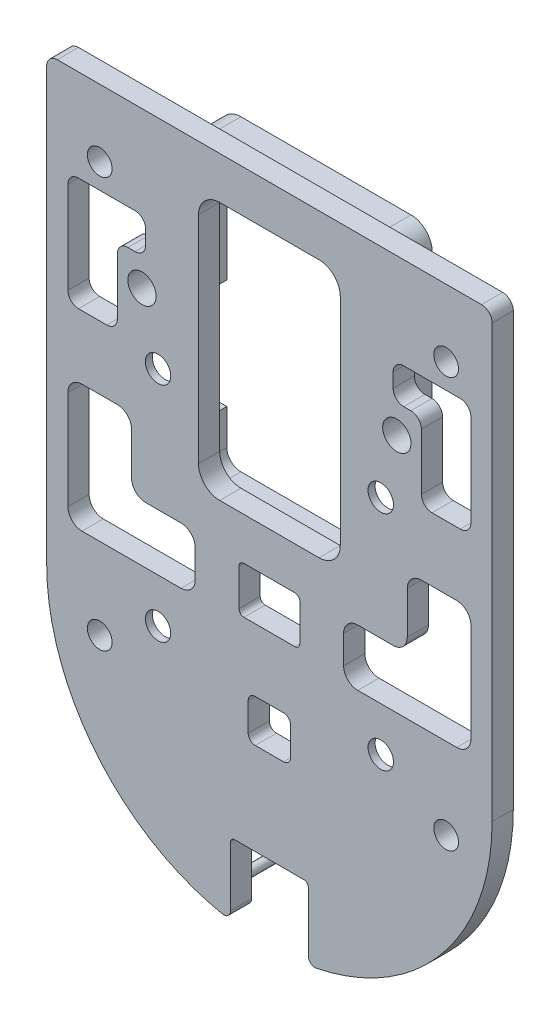
from build123d import *

# Parameters (mm, degrees)
CROQUIS1_R                   = 1.5
SALIENTE_EXTRUIR1_DEPTH      = 3
CROQUIS3_R                   = 0.65
CORTAR_EXTRUIR1_DEPTH        = 57.244999778
CROQUIS5_R                   = 0.65
CROQUIS5_R_2                 = 1.8
CROQUIS5_R_3                 = 1.5
CORTAR_EXTRUIR3_DEPTH        = 57.244999778
REDONDEO1_R                  = 1
SALIENTE_EXTRUIR2_DEPTH      = 5
SALIENTE_EXTRUIR2_DEPTH_BACK = 3
CROQUIS14_R                  = 0.65
SALIENTE_EXTRUIR3_DEPTH      = 5
CROQUIS22_R                  = 2
CORTAR_EXTRUIR14_DEPTH       = 30
CORTAR_EXTRUIR9_DEPTH        = 30
CORTAR_EXTRUIR9_DEPTH_BACK   = 2
CROQUIS16_R                  = 4.8
CROQUIS16_R_2                = 1.8
CORTAR_EXTRUIR15_DEPTH       = 5
CROQUIS11_R                  = 1.75
CORTAR_EXTRUIR6_DEPTH        = 52
CORTAR_EXTRUIR16_DEPTH       = 30
REDONDEO2_R                  = 31


with BuildPart() as part:
    # Croquis1 → Saliente-Extruir1 (new body)
    with BuildSketch(Plane.XY):
        with BuildLine():
            Line((31.5, -46.5), (-31.5, -46.5))
            Line((-31.5, -46.5), (-31.5, -45))
            Line((-31.5, -45), (-31.5, 45))
            ThreePointArc((-31.5, 45), (-31.060660172, 46.060660172), (-30, 46.5))
            Line((-30, 46.5), (30, 46.5))
            ThreePointArc((30, 46.5), (31.060660172, 46.060660172), (31.5, 45))
            Line((31.5, 45), (31.5, -45))
            Line((31.5, -45), (31.5, -46.5))
        make_face()
        with Locations((-15.75, 15.75)):
            Circle(CROQUIS1_R, mode=Mode.SUBTRACT)
        with Locations(Location((15.75, 15.75, 0), (0, 0, 180))):
            Circle(CROQUIS1_R, mode=Mode.SUBTRACT)
        with Locations(Location((-15.75, -15.75, 0), (0, 0, 180))):
            Circle(CROQUIS1_R, mode=Mode.SUBTRACT)
        with Locations((15.75, -15.75)):
            Circle(CROQUIS1_R, mode=Mode.SUBTRACT)
    extrude(amount=SALIENTE_EXTRUIR1_DEPTH)

    # Croquis3 → Cortar-Extruir1 (cut, through all)
    with BuildSketch(Plane.XY.offset(3)):
        with BuildLine():
            ThreePointArc((3, -18.5), (2.707106781, -17.792893219), (2, -17.5))
            Line((2, -17.5), (-2, -17.5))
            ThreePointArc((-2, -17.5), (-2.707106781, -17.792893219), (-3, -18.5))
            Line((-3, -18.5), (-3, -22.5))
            ThreePointArc((-3, -22.5), (-2.707106781, -23.207106781), (-2, -23.5))
            Line((-2, -23.5), (2, -23.5))
            ThreePointArc((2, -23.5), (2.707106781, -23.207106781), (3, -22.5))
            Line((3, -22.5), (3, -18.5))
        make_face()
        with BuildLine():
            Line((3.6, -2.3), (-3.6, -2.3))
            ThreePointArc((-3.6, -2.3), (-3.882842712, -2.417157288), (-4, -2.7))
            Line((-4, -2.7), (-4, -7.9))
            ThreePointArc((-4, -7.9), (-3.882842712, -8.182842712), (-3.6, -8.3))
            Line((-3.6, -8.3), (3.6, -8.3))
            ThreePointArc((3.6, -8.3), (3.882842712, -8.182842712), (4, -7.9))
            Line((4, -7.9), (4, -2.7))
            ThreePointArc((4, -2.7), (3.882842712, -2.417157288), (3.6, -2.3))
        make_face()
        with BuildLine():
            Line((-5.5, -37.1), (-5.5, -46.5))
            Line((-5.5, -46.5), (5.5, -46.5))
            Line((5.5, -46.5), (5.5, -37.1))
            ThreePointArc((5.5, -37.1), (5.324264069, -36.675735931), (4.9, -36.5))
            Line((4.9, -36.5), (-4.9, -36.5))
            ThreePointArc((-4.9, -36.5), (-5.324264069, -36.675735931), (-5.5, -37.1))
        make_face()
        with Locations((-7.62, -3.68)):
            Circle(CROQUIS3_R)
        with Locations(Location((7.62, -3.68, 0), (0, 0, 180))):
            Circle(CROQUIS3_R)
        with Locations(Location((-7.62, -44.12, 0), (0, 0, 180))):
            Circle(CROQUIS3_R)
        with Locations((7.62, -44.12)):
            Circle(CROQUIS3_R)
    extrude(amount=-CORTAR_EXTRUIR1_DEPTH, mode=Mode.SUBTRACT)

    # Croquis5 → Cortar-Extruir3 (cut, through all)
    # profile 1 of 9: a face of its own
    with BuildSketch(Plane.XY.offset(3)):
        with Locations((7.62, -44.12)):
            Circle(CROQUIS5_R)
    # profile 2 of 9: a face of its own
    with BuildSketch(Plane.XY.offset(3)):
        with Locations(Location((-7.62, -44.12, 0), (0, 0, 180))):
            Circle(CROQUIS5_R)
    # profile 3 of 9: a face of its own
    with BuildSketch(Plane.XY.offset(3)):
        with Locations((-7.62, -3.68)):
            Circle(CROQUIS5_R)
    # profile 4 of 9: a face of its own
    with BuildSketch(Plane.XY.offset(3)):
        with Locations(Location((7.62, -3.68, 0), (0, 0, 180))):
            Circle(CROQUIS5_R)
    # profile 5 of 9: a face of its own
    with BuildSketch(Plane.XY.offset(3)):
        with Locations((-15.75, -15.75)):
            Circle(CROQUIS5_R_2)
        with Locations((-15.75, -15.75)):
            Circle(CROQUIS5_R_3, mode=Mode.SUBTRACT)
    # profile 6 of 9: a face of its own
    with BuildSketch(Plane.XY.offset(3)):
        with Locations((15.75, -15.75)):
            Circle(CROQUIS5_R_2)
        with Locations((15.75, -15.75)):
            Circle(CROQUIS5_R_3, mode=Mode.SUBTRACT)
    # profile 7 of 9: a face of its own
    with BuildSketch(Plane.XY.offset(3)):
        with Locations((15.75, 15.75)):
            Circle(CROQUIS5_R_2)
        with Locations((15.75, 15.75)):
            Circle(CROQUIS5_R_3, mode=Mode.SUBTRACT)
    # profile 8 of 9: a face of its own
    with BuildSketch(Plane.XY.offset(3)):
        with Locations((-15.75, 15.75)):
            Circle(CROQUIS5_R_2)
        with Locations((-15.75, 15.75)):
            Circle(CROQUIS5_R_3, mode=Mode.SUBTRACT)
    # profile 9 of 9: a face of its own
    with BuildSketch(Plane.XY.offset(3)):
        with BuildLine():
            Line((4.3, -2.7), (4.3, -7.9))
            ThreePointArc((4.3, -7.9), (4.094974747, -8.394974747), (3.6, -8.6))
            Line((3.6, -8.6), (-3.6, -8.6))
            ThreePointArc((-3.6, -8.6), (-4.094974747, -8.394974747), (-4.3, -7.9))
            Line((-4.3, -7.9), (-4.3, -2.7))
            ThreePointArc((-4.3, -2.7), (-4.094974747, -2.205025253), (-3.6, -2))
            Line((-3.6, -2), (3.6, -2))
            ThreePointArc((3.6, -2), (4.094974747, -2.205025253), (4.3, -2.7))
        make_face()
        with BuildLine():
            Line((4, -2.7), (4, -7.9))
            ThreePointArc((4, -7.9), (3.882842712, -8.182842712), (3.6, -8.3))
            Line((3.6, -8.3), (-3.6, -8.3))
            ThreePointArc((-3.6, -8.3), (-3.882842712, -8.182842712), (-4, -7.9))
            Line((-4, -7.9), (-4, -2.7))
            ThreePointArc((-4, -2.7), (-3.882842712, -2.417157288), (-3.6, -2.3))
            Line((-3.6, -2.3), (3.6, -2.3))
            ThreePointArc((3.6, -2.3), (3.882842712, -2.417157288), (4, -2.7))
        make_face(mode=Mode.SUBTRACT)
    extrude(amount=-CORTAR_EXTRUIR3_DEPTH, mode=Mode.SUBTRACT)

    # Redondeo1
    redondeo1_edges = [part.edges().sort_by_distance(p)[0] for p in [
        (5.5, -46.5, 1.5),
        (-5.5, -46.5, 1.5),
    ]]
    fillet(redondeo1_edges, radius=REDONDEO1_R)

    # Croquis14 → Saliente-Extruir2 (add, two sides: drawn at the far end of the back side and taken through both)
    with BuildSketch(Plane(origin=(0, 0, 0), x_dir=(-1, 0, 0), z_dir=(0, 0, -1)).offset(-SALIENTE_EXTRUIR2_DEPTH_BACK)):
        with Locations((7.62, -44.12)):
            Circle(CROQUIS14_R)
        with Locations((-7.62, -44.12)):
            Circle(CROQUIS14_R)
        with Locations((7.62, -3.68)):
            Circle(CROQUIS14_R)
        with Locations((-7.62, -3.68)):
            Circle(CROQUIS14_R)
    extrude(amount=SALIENTE_EXTRUIR2_DEPTH + SALIENTE_EXTRUIR2_DEPTH_BACK)

    # Croquis18 → Saliente-Extruir3 (add)
    with BuildSketch(Plane(origin=(0, 0, 0), x_dir=(-1, 0, 0), z_dir=(0, 0, -1))):
        with BuildLine():
            Line((-15.025, 3), (-15.025, 41.5))
            ThreePointArc((-15.025, 41.5), (-14.146320344, 43.621320344), (-12.025, 44.5))
            Line((-12.025, 44.5), (12.025, 44.5))
            ThreePointArc((12.025, 44.5), (14.146320344, 43.621320344), (15.025, 41.5))
            Line((15.025, 41.5), (15.025, 3))
            ThreePointArc((15.025, 3), (14.146320344, 0.878679656), (12.025, 0))
            Line((12.025, 0), (-12.025, 0))
            ThreePointArc((-12.025, 0), (-14.146320344, 0.878679656), (-15.025, 3))
        make_face()
        with BuildLine():
            Line((12.025, 1), (-12.025, 1))
            ThreePointArc((-12.025, 1), (-13.439213562, 1.585786438), (-14.025, 3))
            Line((-14.025, 3), (-14.025, 41.5))
            ThreePointArc((-14.025, 41.5), (-13.439213562, 42.914213562), (-12.025, 43.5))
            Line((-12.025, 43.5), (12.025, 43.5))
            ThreePointArc((12.025, 43.5), (13.439213562, 42.914213562), (14.025, 41.5))
            Line((14.025, 41.5), (14.025, 3))
            ThreePointArc((14.025, 3), (13.439213562, 1.585786438), (12.025, 1))
        make_face(mode=Mode.SUBTRACT)
    extrude(amount=SALIENTE_EXTRUIR3_DEPTH)

    # Croquis22 → Cortar-Extruir14 (cut)
    with BuildSketch(Plane(origin=(0, 0, 0), x_dir=(-1, 0, 0), z_dir=(0, 0, -1))):
        with Locations((18.025, 24.5)):
            Circle(CROQUIS22_R)
        with Locations((-18.025, 24.5)):
            Circle(CROQUIS22_R)
    extrude(amount=-CORTAR_EXTRUIR14_DEPTH, mode=Mode.SUBTRACT)

    # Croquis16 → Cortar-Extruir9 (cut, two sides: drawn at the far end of the back side and taken through both)
    # profile 1 of 4: a face of its own
    with BuildSketch(Plane(origin=(0, 0, 0), x_dir=(-1, 0, 0), z_dir=(0, 0, -1)).offset(-CORTAR_EXTRUIR9_DEPTH_BACK)):
        with Locations(Location((15.75, -15.75, 0), (0, 0, 180))):
            Circle(CROQUIS16_R)
        with Locations(Location((15.75, -15.75, 0), (0, 0, 180))):
            Circle(CROQUIS16_R_2, mode=Mode.SUBTRACT)
    # profile 2 of 4: a face of its own
    with BuildSketch(Plane(origin=(0, 0, 0), x_dir=(-1, 0, 0), z_dir=(0, 0, -1)).offset(-CORTAR_EXTRUIR9_DEPTH_BACK)):
        with Locations(Location((-15.75, -15.75, 0), (0, 0, 180))):
            Circle(CROQUIS16_R)
        with Locations(Location((-15.75, -15.75, 0), (0, 0, 180))):
            Circle(CROQUIS16_R_2, mode=Mode.SUBTRACT)
    # profile 3 of 4: a face of its own
    with BuildSketch(Plane(origin=(0, 0, 0), x_dir=(-1, 0, 0), z_dir=(0, 0, -1)).offset(-CORTAR_EXTRUIR9_DEPTH_BACK)):
        with Locations(Location((-15.75, 15.75, 0), (0, 0, 81.312702519))):
            Circle(CROQUIS16_R)
        with Locations(Location((-15.75, 15.75, 0), (0, 0, 180))):
            Circle(CROQUIS16_R_2, mode=Mode.SUBTRACT)
    # profile 4 of 4: a face of its own
    with BuildSketch(Plane(origin=(0, 0, 0), x_dir=(-1, 0, 0), z_dir=(0, 0, -1)).offset(-CORTAR_EXTRUIR9_DEPTH_BACK)):
        with Locations(Location((15.75, 15.75, 0), (0, 0, 248.938182398))):
            Circle(CROQUIS16_R)
        with Locations(Location((15.75, 15.75, 0), (0, 0, 180))):
            Circle(CROQUIS16_R_2, mode=Mode.SUBTRACT)
    extrude(amount=CORTAR_EXTRUIR9_DEPTH + CORTAR_EXTRUIR9_DEPTH_BACK, mode=Mode.SUBTRACT)


with BuildPart() as cortar_extruir9_piece_1:
    # of the separate pieces the step leaves, piece 1, a body of its own (cortar_extruir9_pieces)
    add(part.part.solids().sort_by_distance((6.5, -46.5, 0))[0])


with BuildPart() as cortar_extruir9_piece_2:
    # of the separate pieces the step leaves, piece 2, a body of its own (cortar_extruir9_pieces)
    add(part.part.solids().sort_by_distance((15.025, 14.102463961, 0))[0])


with BuildPart() as cortar_extruir9_piece_3:
    # of the separate pieces the step leaves, piece 3, a body of its own (cortar_extruir9_pieces)
    add(part.part.solids().sort_by_distance((-15.025, 17.397536039, 0))[0])


with BuildPart() as cortar_extruir15_tool:
    # Croquis23 → Cortar-Extruir15 (new body)
    with BuildSketch(Plane(origin=(0, 0, -5), x_dir=(-1, 0, 0), z_dir=(0, 0, -1))):
        with BuildLine():
            Line((-14.025, 8.005068494), (-15.025, 8.005068494))
            Line((-15.025, 8.005068494), (-15.025, 11.005068494))
            ThreePointArc((-15.025, 11.005068494), (-14.517822509, 11.110847208), (-14.025, 11.270672484))
            Line((-14.025, 11.270672484), (-14.025, 8.005068494))
        make_face()
        with BuildLine():
            Line((15.025, 20.494931506), (15.025, 23.494931506))
            Line((15.025, 23.494931506), (14.025, 23.494931506))
            Line((14.025, 23.494931506), (14.025, 20.229327516))
            ThreePointArc((14.025, 20.229327516), (14.517822509, 20.389152792), (15.025, 20.494931506))
        make_face()
        with BuildLine():
            Line((-15.025, 23.494931506), (-15.025, 20.494931506))
            ThreePointArc((-15.025, 20.494931506), (-14.517822509, 20.389152792), (-14.025, 20.229327516))
            Line((-14.025, 20.229327516), (-14.025, 23.494931506))
            Line((-14.025, 23.494931506), (-15.025, 23.494931506))
        make_face()
        with BuildLine():
            Line((14.025, 11.270672484), (14.025, 8.005068494))
            Line((14.025, 8.005068494), (15.025, 8.005068494))
            Line((15.025, 8.005068494), (15.025, 11.005068494))
            ThreePointArc((15.025, 11.005068494), (14.517822509, 11.110847208), (14.025, 11.270672484))
        make_face()
        with BuildLine():
            Line((-15.025, 17.397536039), (-15.025, 14.102463961))
            ThreePointArc((-15.025, 14.102463961), (-14.400276945, 14.559097957), (-14.025, 15.235825905))
            Line((-14.025, 15.235825905), (-14.025, 16.264174095))
            ThreePointArc((-14.025, 16.264174095), (-14.400276945, 16.940902043), (-15.025, 17.397536039))
        make_face()
        with BuildLine():
            Line((14.025, 16.264174095), (14.025, 15.235825905))
            ThreePointArc((14.025, 15.235825905), (14.400276945, 14.559097957), (15.025, 14.102463961))
            Line((15.025, 14.102463961), (15.025, 17.397536039))
            ThreePointArc((15.025, 17.397536039), (14.400276945, 16.940902043), (14.025, 16.264174095))
        make_face()
    extrude(amount=-CORTAR_EXTRUIR15_DEPTH)


with BuildPart() as cortar_extruir9_piece_1_1:
    add(cortar_extruir9_piece_1.part)

    # Cortar-Extruir15: cut by cortar_extruir15_tool
    add(cortar_extruir15_tool.part, mode=Mode.SUBTRACT)

    # Croquis11 → Cortar-Extruir6 (cut)
    with BuildSketch(Plane.XY.offset(3)):
        with Locations((-24, 37)):
            Circle(CROQUIS11_R)
        with Locations((25, -21)):
            Circle(CROQUIS11_R)
        with Locations((25, 37)):
            Circle(CROQUIS11_R)
        with Locations((-24, -21)):
            Circle(CROQUIS11_R)
    extrude(amount=-CORTAR_EXTRUIR6_DEPTH, mode=Mode.SUBTRACT)

    # Croquis24 → Cortar-Extruir16 (cut)
    with BuildSketch(Plane(origin=(0, 0, 0), x_dir=(-1, 0, 0), z_dir=(0, 0, -1))):
        with BuildLine():
            ThreePointArc((-26.5, -9.5), (-27.914213562, -8.914213562), (-28.5, -7.5))
            Line((-28.5, -7.5), (-28.5, -3.47606194))
            Line((-28.5, -3.47606194), (-28.5, 6.5))
            ThreePointArc((-28.5, 6.5), (-27.914213562, 7.914213562), (-26.5, 8.5))
            Line((-26.5, 8.5), (-21.5, 8.5))
            ThreePointArc((-21.5, 8.5), (-20.085786438, 7.914213562), (-19.5, 6.5))
            Line((-19.5, 6.5), (-19.5, 0.5))
            ThreePointArc((-19.5, 0.5), (-18.914213562, -0.914213562), (-17.5, -1.5))
            Line((-17.5, -1.5), (-12.5, -1.5))
            ThreePointArc((-12.5, -1.5), (-11.085786438, -2.085786438), (-10.5, -3.5))
            Line((-10.5, -3.5), (-10.5, -7.5))
            ThreePointArc((-10.5, -7.5), (-11.085786438, -8.914213562), (-12.5, -9.5))
            Line((-12.5, -9.5), (-26.5, -9.5))
        make_face()
        with BuildLine():
            Line((10.5, -7.5), (10.5, -3.5))
            ThreePointArc((10.5, -3.5), (11.085786438, -2.085786438), (12.5, -1.5))
            Line((12.5, -1.5), (17.5, -1.5))
            ThreePointArc((17.5, -1.5), (18.914213562, -0.914213562), (19.5, 0.5))
            Line((19.5, 0.5), (19.5, 6.5))
            ThreePointArc((19.5, 6.5), (20.085786438, 7.914213562), (21.5, 8.5))
            Line((21.5, 8.5), (26.5, 8.5))
            ThreePointArc((26.5, 8.5), (27.914213562, 7.914213562), (28.5, 6.5))
            Line((28.5, 6.5), (28.5, -3.47606194))
            Line((28.5, -3.47606194), (28.5, -7.5))
            ThreePointArc((28.5, -7.5), (27.914213562, -8.914213562), (26.5, -9.5))
            Line((26.5, -9.5), (12.5, -9.5))
            ThreePointArc((12.5, -9.5), (11.085786438, -8.914213562), (10.5, -7.5))
        make_face()
        with BuildLine():
            Line((-7.025, 4), (0, 4))
            Line((0, 4), (0, 40.5))
            Line((0, 40.5), (-7.025, 40.5))
            ThreePointArc((-7.025, 40.5), (-9.146320344, 39.621320344), (-10.025, 37.5))
            Line((-10.025, 37.5), (-10.025, 7))
            ThreePointArc((-10.025, 7), (-9.146320344, 4.878679656), (-7.025, 4))
        make_face()
        with BuildLine():
            Line((0, 4), (7.025, 4))
            ThreePointArc((7.025, 4), (9.146320344, 4.878679656), (10.025, 7))
            Line((10.025, 7), (10.025, 37.5))
            ThreePointArc((10.025, 37.5), (9.146320344, 39.621320344), (7.025, 40.5))
            Line((7.025, 40.5), (0, 40.5))
            Line((0, 40.5), (0, 4))
        make_face()
        with BuildLine():
            Line((-28.5, 32), (-28.5, 19))
            ThreePointArc((-28.5, 19), (-28.060660172, 17.939339828), (-27, 17.5))
            Line((-27, 17.5), (-23, 17.5))
            ThreePointArc((-23, 17.5), (-21.939339828, 17.939339828), (-21.5, 19))
            Line((-21.5, 19), (-21.5, 27))
            ThreePointArc((-21.5, 27), (-21.060660172, 28.060660172), (-20, 28.5))
            Line((-20, 28.5), (-19, 28.5))
            ThreePointArc((-19, 28.5), (-17.939339828, 28.939339828), (-17.5, 30))
            Line((-17.5, 30), (-17.5, 32))
            ThreePointArc((-17.5, 32), (-17.939339828, 33.060660172), (-19, 33.5))
            Line((-19, 33.5), (-27, 33.5))
            ThreePointArc((-27, 33.5), (-28.060660172, 33.060660172), (-28.5, 32))
        make_face()
        with BuildLine():
            Line((28.5, 32), (28.5, 19))
            ThreePointArc((28.5, 19), (28.060660172, 17.939339828), (27, 17.5))
            Line((27, 17.5), (23, 17.5))
            ThreePointArc((23, 17.5), (21.939339828, 17.939339828), (21.5, 19))
            Line((21.5, 19), (21.5, 27))
            ThreePointArc((21.5, 27), (21.060660172, 28.060660172), (20, 28.5))
            Line((20, 28.5), (19, 28.5))
            ThreePointArc((19, 28.5), (17.939339828, 28.939339828), (17.5, 30))
            Line((17.5, 30), (17.5, 32))
            ThreePointArc((17.5, 32), (17.939339828, 33.060660172), (19, 33.5))
            Line((19, 33.5), (27, 33.5))
            ThreePointArc((27, 33.5), (28.060660172, 33.060660172), (28.5, 32))
        make_face()
    extrude(amount=-CORTAR_EXTRUIR16_DEPTH, mode=Mode.SUBTRACT)

    # Redondeo2
    # the kernel refuses this fillet: 31 mm, written as the material it takes off along each edge
    with BuildSketch(Plane(origin=(-31.5, -46.5, -76.034531629), x_dir=(0, 1, 0), z_dir=(0, 0, 1))) as redondeo2_piece_1:
        with BuildLine():
            CenterArc((30.413812651, -31), REDONDEO2_R, 90, 78.840063128)
            Line((0, -25), (0, 0))
            Line((0, 0), (30.413812651, 0))
        make_face()
    extrude(amount=155.069063257, mode=Mode.SUBTRACT)
    with BuildSketch(Plane(origin=(31.5, -46.5, -76.034531629), x_dir=(-1, 0, 0), z_dir=(0, 0, 1))) as redondeo2_piece_2:
        with BuildLine():
            CenterArc((31, -30.413812651), REDONDEO2_R, 101.159936872, 78.840063128)
            Line((0, -30.413812651), (0, 0))
            Line((0, 0), (25, 0))
        make_face()
    extrude(amount=155.069063257, mode=Mode.SUBTRACT)


with BuildPart() as cortar_extruir9_piece_2_1:
    add(cortar_extruir9_piece_2.part)

    # Cortar-Extruir15: cut by cortar_extruir15_tool
    add(cortar_extruir15_tool.part, mode=Mode.SUBTRACT)


with BuildPart() as cortar_extruir9_piece_3_1:
    add(cortar_extruir9_piece_3.part)

    # Cortar-Extruir15: cut by cortar_extruir15_tool
    add(cortar_extruir15_tool.part, mode=Mode.SUBTRACT)


solid = cortar_extruir9_piece_1_1.part
